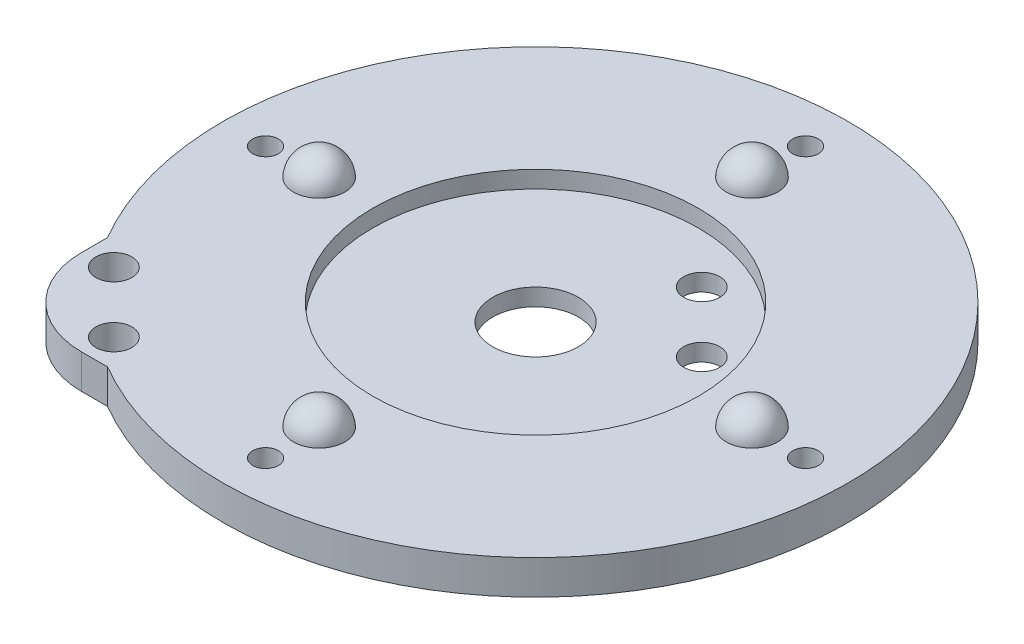
from build123d import *

# Parameters (mm, degrees)
SKETCH1_R           = 2.1
SKETCH1_R_2         = 1.5
SKETCH1_R_3         = 3
SKETCH1_R_4         = 19
BOSS_EXTRUDE1_DEPTH = 4
BOSS_EXTRUDE2_DEPTH = 2
FILLET1_R           = 10
SKETCH1_4_R         = 3
BOSS_EXTRUDE3_DEPTH = 6.9
FILLET2_R           = 3


with BuildPart() as part:
    # Sketch1 → Boss-Extrude1 (new body)
    with BuildSketch(Plane(origin=(0, 0, 0), x_dir=(1, 0, 0), z_dir=(0, 1, 0))):
        with BuildLine():
            ThreePointArc((-18.439088915, -31.5), (25.809397513, 25.809397513), (-31.5, -18.439088915))
            Line((-31.5, -18.439088915), (-31.5, -31.5))
            Line((-31.5, -31.5), (-18.439088915, -31.5))
        make_face()
        with Locations(Location((-28.135778823, -21.064711012, 0), (0, 0, 270))):
            Circle(SKETCH1_R, mode=Mode.SUBTRACT)
        with Locations(Location((-21.064711012, -28.135778823, 0), (0, 0, 270))):
            Circle(SKETCH1_R, mode=Mode.SUBTRACT)
        with Locations(Location((0, -31.5, 0), (0, 0, 270))):
            Circle(SKETCH1_R_2, mode=Mode.SUBTRACT)
        with Locations(Location((0, -25.25, 0), (0, 0, 270))):
            Circle(SKETCH1_R_3, mode=Mode.SUBTRACT)
        with Locations(Location((-31.5, 0, 0), (0, 0, 270))):
            Circle(SKETCH1_R_2, mode=Mode.SUBTRACT)
        with Locations(Location((-25.25, 0, 0), (0, 0, 270))):
            Circle(SKETCH1_R_3, mode=Mode.SUBTRACT)
        with Locations(Location((0, 0, 0), (0, 0, 270))):
            Circle(SKETCH1_R_4, mode=Mode.SUBTRACT)
        with Locations(Location((25.25, 0, 0), (0, 0, 270))):
            Circle(SKETCH1_R_3, mode=Mode.SUBTRACT)
        with Locations(Location((31.5, 0, 0), (0, 0, 270))):
            Circle(SKETCH1_R_2, mode=Mode.SUBTRACT)
        with Locations(Location((0, 25.25, 0), (0, 0, 270))):
            Circle(SKETCH1_R_3, mode=Mode.SUBTRACT)
        with Locations(Location((0, 31.5, 0), (0, 0, 270))):
            Circle(SKETCH1_R_2, mode=Mode.SUBTRACT)
    extrude(amount=BOSS_EXTRUDE1_DEPTH)

    # Sketch1<3> → Boss-Extrude2 (add)
    with BuildSketch(Plane(origin=(0, 0, 0), x_dir=(1, 0, 0), z_dir=(0, 1, 0))):
        with BuildLine():
            ThreePointArc((0, 19), (-17.553711118, 7.270985215), (-13.435028843, -13.435028843))
            ThreePointArc((-13.435028843, -13.435028843), (7.270985215, -17.553711118), (19, 0))
            ThreePointArc((19, 0), (13.435028843, 13.435028843), (0, 19))
        make_face()
        with BuildLine():
            ThreePointArc((-3.535533906, -3.535533906), (-3.535533906, 3.535533906), (3.535533906, 3.535533906))
            ThreePointArc((3.535533906, 3.535533906), (4.619397663, 1.913417162), (5, 0))
            ThreePointArc((5, 0), (1.913417162, -4.619397663), (-3.535533906, -3.535533906))
        make_face(mode=Mode.SUBTRACT)
        with BuildLine():
            ThreePointArc((15.329967876, 6.158900064), (12.426332668, 4.218753046), (11.745043636, 7.643824305))
            ThreePointArc((11.745043636, 7.643824305), (14.033603084, 8.099047082), (15.329967876, 6.158900064))
        make_face(mode=Mode.SUBTRACT)
        with BuildLine():
            ThreePointArc((8.258900064, 13.229967876), (8.099047082, 12.426332668), (7.643824305, 11.745043636))
            ThreePointArc((7.643824305, 11.745043636), (4.218753046, 14.033603084), (8.258900064, 13.229967876))
        make_face(mode=Mode.SUBTRACT)
    extrude(amount=BOSS_EXTRUDE2_DEPTH)

    # Fillet1
    fillet1_edges = [part.edges().sort_by_distance(p)[0] for p in [
        (-31.5, 2, 31.5),
    ]]
    fillet(fillet1_edges, radius=FILLET1_R)

    # Sketch1<4> → Boss-Extrude3 (add)
    with BuildSketch(Plane(origin=(0, 0, 0), x_dir=(1, 0, 0), z_dir=(0, 1, 0))):
        with Locations(Location((0, 25.25, 0), (0, 0, 90))):
            Circle(SKETCH1_4_R)
        with Locations(Location((25.25, 0, 0), (0, 0, 90))):
            Circle(SKETCH1_4_R)
        with Locations(Location((0, -25.25, 0), (0, 0, 90))):
            Circle(SKETCH1_4_R)
        with Locations(Location((-25.25, 0, 0), (0, 0, 90))):
            Circle(SKETCH1_4_R)
    extrude(amount=BOSS_EXTRUDE3_DEPTH)

    # Fillet2
    # the kernel refuses this fillet: 3 mm, written as the material it takes off along each edge
    with BuildSketch(Plane(origin=(0, 6.9, -25.25), x_dir=(0, 0, -1), z_dir=(1, 0, 0))) as fillet2_piece_1:
        with BuildLine():
            CenterArc((0.00166713, -3), FILLET2_R, 1.910213172, 88.089786828)
            Line((0.00166713, 0), (0.00166713, 0.06))
            Line((0.00166713, 0.06), (3, 0.06))
            Line((3, 0.06), (3.06, 0))
            ThreePointArc((3.06, 0), (3.06, -1.45), (3.059966657, -2.898))
            Line((3.059966657, -2.898), (3, -2.9))
        make_face()
    revolve(axis=Axis((0, 6.9, -25.25), (0, 1, 0)), mode=Mode.SUBTRACT)
    with BuildSketch(Plane(origin=(-25.25, 6.9, 0), x_dir=(0, 0, -1), z_dir=(1, 0, 0))) as fillet2_piece_2:
        with BuildLine():
            CenterArc((0.00166713, -3), FILLET2_R, 1.910213172, 88.089786828)
            Line((0.00166713, 0), (0.00166713, 0.06))
            Line((0.00166713, 0.06), (3, 0.06))
            Line((3, 0.06), (3.06, 0))
            ThreePointArc((3.06, 0), (3.06, -1.45), (3.059966657, -2.898))
            Line((3.059966657, -2.898), (3, -2.9))
        make_face()
    revolve(axis=Axis((-25.25, 6.9, 0), (0, 1, 0)), mode=Mode.SUBTRACT)
    with BuildSketch(Plane(origin=(25.25, 6.9, 0), x_dir=(0, 0, -1), z_dir=(1, 0, 0))) as fillet2_piece_3:
        with BuildLine():
            CenterArc((0.00166713, -3), FILLET2_R, 1.910213172, 88.089786828)
            Line((0.00166713, 0), (0.00166713, 0.06))
            Line((0.00166713, 0.06), (3, 0.06))
            Line((3, 0.06), (3.06, 0))
            ThreePointArc((3.06, 0), (3.06, -1.45), (3.059966657, -2.898))
            Line((3.059966657, -2.898), (3, -2.9))
        make_face()
    revolve(axis=Axis((25.25, 6.9, 0), (0, 1, 0)), mode=Mode.SUBTRACT)
    with BuildSketch(Plane(origin=(0, 6.9, 25.25), x_dir=(0, 0, -1), z_dir=(1, 0, 0))) as fillet2_piece_4:
        with BuildLine():
            CenterArc((0.00166713, -3), FILLET2_R, 1.910213172, 88.089786828)
            Line((0.00166713, 0), (0.00166713, 0.06))
            Line((0.00166713, 0.06), (3, 0.06))
            Line((3, 0.06), (3.06, 0))
            ThreePointArc((3.06, 0), (3.06, -1.45), (3.059966657, -2.898))
            Line((3.059966657, -2.898), (3, -2.9))
        make_face()
    revolve(axis=Axis((0, 6.9, 25.25), (0, 1, 0)), mode=Mode.SUBTRACT)


solid = part.part
